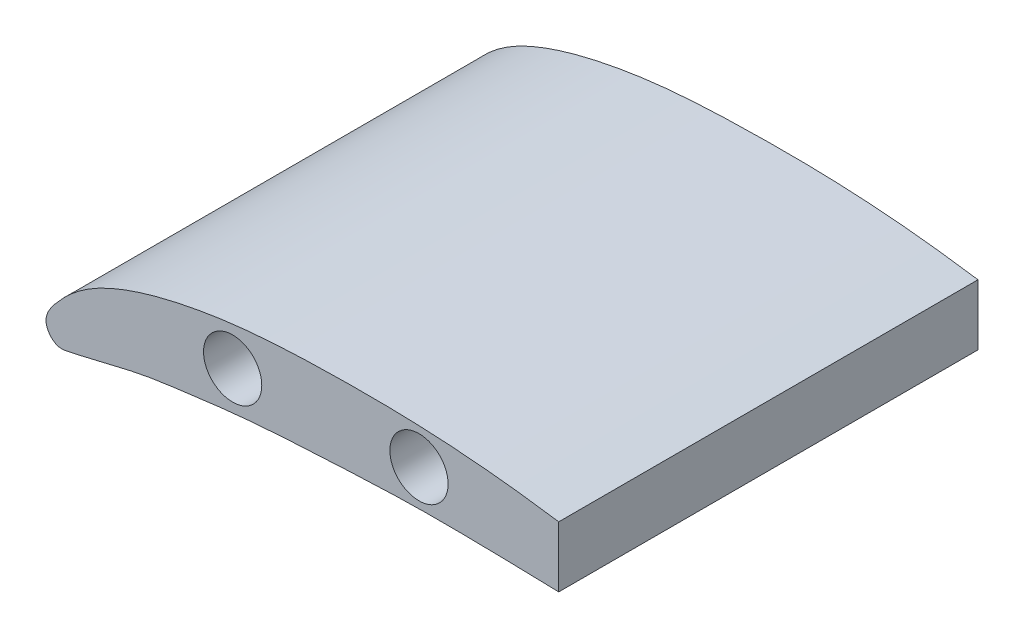
from build123d import *

# Parameters (mm, degrees)
SKETCH1_R           = 7.9375
BOSS_EXTRUDE1_DEPTH = 114.3


with BuildPart() as part:
    # Sketch1 → Boss-Extrude1 (new body)
    with BuildSketch(Plane.XY):
        with BuildLine():
            Line((139.7, 6.609889233), (139.7, 23.166170772))
            add(Edge.make_bspline(
                [(139.7, 23.166170772), (135.380629795, 23.805959403), (122.631010328, 25.528179282), (101.33320634, 27.152888319), (75.88557757, 27.17734948), (54.641071173, 26.194471962), (37.724116321, 23.47833263), (27.14178847, 20.862824139), (18.701701524, 17.836375149), (12.224566958, 14.719230964), (6.864342268, 10.853542834), (2.512358556, 6.225814587), (-1.732901636, 0.897528071), (2.557139286, -4.257017376), (7.562408352, -3.187950948), (12.698175589, -1.978811967), (19.049778871, -0.42591776), (27.433172343, 1.486520759), (38.05513002, 2.872460295), (54.924851174, 5.063535671), (76.118727982, 6.226952187), (101.511907224, 7.472150191), (122.714776143, 7.038119868), (135.441485908, 6.737356423), (139.7, 6.609889233)],
                knots=[0.223089178, 0.223089178, 0.223089178, 0.223089178, 0.248177787, 0.297011092, 0.345668692, 0.394384357, 0.418981925, 0.444018059, 0.456912726, 0.470404889, 0.485361367, 0.494028905, 0.508284262, 0.517561661, 0.523649238, 0.536104637, 0.548578769, 0.561002029, 0.585561942, 0.610032722, 0.658766283, 0.707434666, 0.756093744, 0.780575159, 0.780575159, 0.780575159, 0.780575159], degree=3))
        make_face()
        with Locations((50.8, 14.91092753)):
            Circle(SKETCH1_R, mode=Mode.SUBTRACT)
        with Locations((101.6, 17.001205357)):
            Circle(SKETCH1_R, mode=Mode.SUBTRACT)
    extrude(amount=BOSS_EXTRUDE1_DEPTH)


solid = part.part
